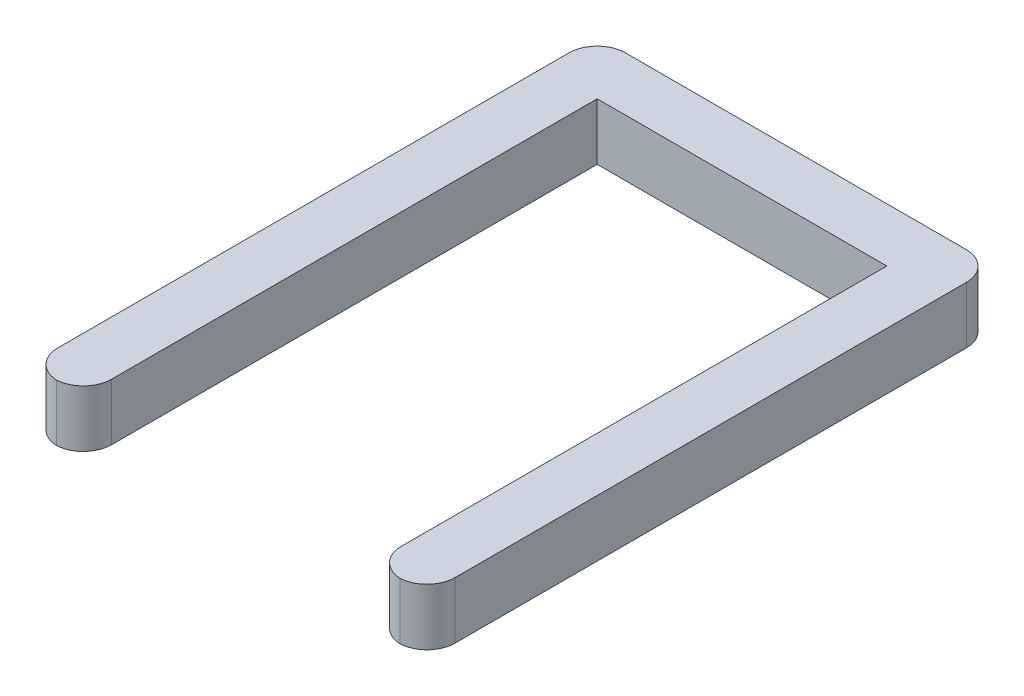
from build123d import *

# Parameters (mm, degrees)
CROQUIS1_W              = 70
CROQUIS1_H              = 100
SALIENTE_EXTRUIR1_DEPTH = 10
CROQUIS2_W              = 51
CROQUIS2_H              = 90.5
CORTAR_EXTRUIR1_DEPTH   = 10
REDONDEO1_R             = 5


with BuildPart() as part:
    # Croquis1 → Saliente-Extruir1 (new body)
    with BuildSketch(Plane(origin=(0, 0, 0), x_dir=(1, 0, 0), z_dir=(0, 1, 0))):
        with Locations((35, -50)):
            Rectangle(CROQUIS1_W, CROQUIS1_H)
    extrude(amount=SALIENTE_EXTRUIR1_DEPTH)

    # Croquis2 → Cortar-Extruir1 (cut)
    with BuildSketch(Plane(origin=(0, 10, 0), x_dir=(1, 0, 0), z_dir=(0, 1, 0))):
        with Locations((35, -54.75)):
            Rectangle(CROQUIS2_W, CROQUIS2_H)
    extrude(amount=-CORTAR_EXTRUIR1_DEPTH, mode=Mode.SUBTRACT)

    # Redondeo1
    # the kernel refuses this fillet: 5 mm, written as the material it takes off along each edge
    with BuildSketch(Plane(origin=(9.5, 22.5, 100), x_dir=(-1, 0, 0), z_dir=(0, -1, 0)), Plane(origin=(70, -12.5, 100), x_dir=(0, 0, -1), z_dir=(0, 1, 0)), Plane(origin=(70, -12.5, 0), x_dir=(-1, 0, 0), z_dir=(0, 1, 0))) as redondeo1_piece_1:
        with BuildLine():
            CenterArc((REDONDEO1_R, REDONDEO1_R), REDONDEO1_R, 180, 90)
            Line((0, REDONDEO1_R), (0, 0))
            Line((0, 0), (REDONDEO1_R, 0))
        make_face()
    extrude(amount=35, mode=Mode.SUBTRACT)
    with BuildSketch(Plane(origin=(60.5, 22.5, 100), x_dir=(1, 0, 0), z_dir=(0, -1, 0)), Plane(origin=(0, -12.5, 0), x_dir=(1, 0, 0), z_dir=(0, 1, 0)), Plane(origin=(0, -12.5, 100), x_dir=(0, 0, -1), z_dir=(0, 1, 0))) as redondeo1_piece_2:
        with BuildLine():
            CenterArc((REDONDEO1_R, -REDONDEO1_R), REDONDEO1_R, 90, 90)
            Line((0, -REDONDEO1_R), (0, 0))
            Line((0, 0), (REDONDEO1_R, 0))
        make_face()
    extrude(amount=35, mode=Mode.SUBTRACT)


solid = part.part
